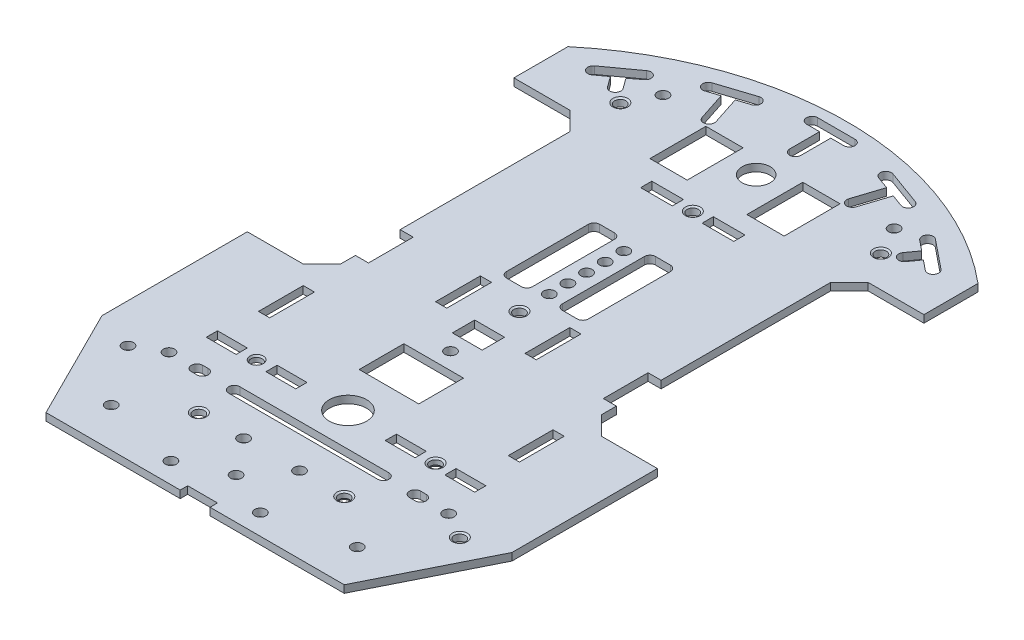
from build123d import *
from OCP.BRepFilletAPI import BRepFilletAPI_MakeChamfer

# Parameters (mm, degrees)
BOSS_EXTRU_1_DEPTH                   = 2
ENL_V_MAT_EXTRU_1_REACH              = 185.45
ENL_V_MAT_EXTRU_43_REACH             = 185.45
ESQUISSE44_R                         = 1.5
ENL_V_MAT_EXTRU_44_REACH             = 185.45
ESQUISSE45_R                         = 1.5
ENL_V_MAT_EXTRU_45_REACH             = 185.45
ESQUISSE46_W                         = 25
ESQUISSE46_H                         = 71.5
CHANFREIN5_SIZE                      = 5
ENL_V_MAT_EXTRU_46_REACH             = 185.45
ESQUISSE47_W                         = 7
ESQUISSE47_H                         = 12
ENL_V_MAT_EXTRU_47_REACH             = 185.45
ESQUISSE48_W                         = 4
ESQUISSE48_H                         = 2
ENL_V_MAT_EXTRU_48_REACH             = 185.45
ESQUISSE49_W                         = 10
ESQUISSE49_H                         = 15
ENL_V_MAT_EXTRU_49_REACH             = 185.45
ESQUISSE50_W                         = 8.5
ESQUISSE50_H                         = 3
ENL_V_MAT_EXTRU_50_REACH             = 185.45
ESQUISSE51_W                         = 7
ESQUISSE51_H                         = 25
CONG_1_R                             = 1.5
ENL_V_MAT_EXTRU_51_REACH             = 185.45
ESQUISSE52_W                         = 3
ESQUISSE52_H                         = 12
ENL_V_MAT_EXTRU_52_REACH             = 185.45
ESQUISSE53_W                         = 4
ESQUISSE53_H                         = 6
ENL_V_MAT_EXTRU_53_REACH             = 185.45
ESQUISSE54_W                         = 8
ESQUISSE54_H                         = 12
ENL_V_MAT_EXTRU_54_REACH             = 185.45
ESQUISSE55_W                         = 3
ESQUISSE55_H                         = 12
ENL_V_MAT_EXTRU_55_REACH             = 185.45
ESQUISSE56_W                         = 8
ESQUISSE56_H                         = 3
ENL_V_MAT_EXTRU_56_REACH             = 185.45
ESQUISSE57_W                         = 8
ESQUISSE57_H                         = 3
ENL_V_MAT_EXTRU_57_REACH             = 185.45
ENL_V_MAT_EXTRU_58_REACH             = 185.45
ESQUISSE59_R                         = 1.5
ENL_V_MAT_EXTRU_58_DIRECTION_2_DEPTH = 184.45026574
ENL_V_MAT_EXTRU_59_REACH             = 185.45
ENL_V_MAT_EXTRU_60_REACH             = 185.45
ESQUISSE61_R                         = 1.5
ENL_V_MAT_EXTRU_61_REACH             = 185.45
ESQUISSE62_R                         = 1.5
ENL_V_MAT_EXTRU_62_REACH             = 185.45
ESQUISSE63_R                         = 1.5
CHANFREIN6_SIZE                      = 0.5
CHANFREIN6_SIZE2                     = 0.288675135
ENL_V_MAT_EXTRU_63_REACH             = 185.45
ESQUISSE64_R                         = 1.5
ENL_V_MAT_EXTRU_64_REACH             = 185.45
ESQUISSE65_R                         = 1.5
ENL_V_MAT_EXTRU_65_REACH             = 185.45
ESQUISSE66_R                         = 1.5
ENL_V_MAT_EXTRU_66_REACH             = 185.45
ESQUISSE67_R                         = 5
ENL_V_MAT_EXTRU_67_REACH             = 185.45
ESQUISSE68_R                         = 1.5
ENL_V_MAT_EXTRU_68_REACH             = 185.45
ESQUISSE69_R                         = 1.5
CHANFREIN7_SIZE                      = 0.5
CHANFREIN7_SIZE2                     = 0.288675135
ENL_V_MAT_EXTRU_69_REACH             = 185.45
ESQUISSE70_R                         = 1.5
R_P_TITION_LIN_AIRE1_COUNT           = 5
R_P_TITION_LIN_AIRE1_PITCH           = 5
ENL_V_MAT_EXTRU_70_REACH             = 185.45
ESQUISSE71_R                         = 1.5
ENL_V_MAT_EXTRU_71_REACH             = 185.45
ESQUISSE72_R                         = 3.75
CHANFREIN8_SIZE                      = 0.5
CHANFREIN8_SIZE2                     = 0.288675135
CHANFREIN9_SIZE                      = 0.5
CHANFREIN9_SIZE2                     = 0.288675135
ENL_V_MAT_EXTRU_72_REACH             = 185.45
ESQUISSE73_R                         = 1.5
CHANFREIN10_SIZE                     = 0.5
CHANFREIN10_SIZE2                    = 0.288675135
CHANFREIN11_SIZE                     = 0.5
CHANFREIN11_SIZE2                    = 0.288675135
ENL_V_MAT_EXTRU_78_REACH             = 185.45
ENL_V_MAT_EXTRU_79_REACH             = 185.45
ENL_V_MAT_EXTRU_80_REACH             = 185.45
CHANFREIN12_SIZE                     = 0.5
CHANFREIN12_SIZE2                    = 0.288675135
CHANFREIN13_SIZE                     = 0.5
CHANFREIN13_SIZE2                    = 0.288675135
CHANFREIN14_SIZE                     = 0.5
CHANFREIN14_SIZE2                    = 0.288675135
CHANFREIN4_SIZE                      = 0.5
CHANFREIN4_SIZE2                     = 0.288675135


# Read off the part's stored shape, not the designer's step: Symétrie1
with BuildPart() as part:
    # Esquisse1 → Boss.-Extru.1 (new body)
    with BuildSketch(Plane(origin=(0, 0, 0), x_dir=(1, 0, 0), z_dir=(0, 1, 0))):
        with BuildLine():
            Line((0, 175), (0, 0))
            Line((0, 0), (55, 0))
            Line((55, 0), (55, 155))
            ThreePointArc((55, 155), (29.261749777, 169.844811886), (0, 175))
        make_face()
    extrude(amount=BOSS_EXTRU_1_DEPTH)

    # Esquisse2 → Enlèv. mat.-Extru.1 (cut, up to next)
    with BuildSketch(Plane(origin=(0, 2, 0), x_dir=(1, 0, 0), z_dir=(0, 1, 0)), mode=Mode.PRIVATE) as enl_v_mat_extru_1_sk1:
        Polygon((55, 0), (40, 0), (55, 30), align=None)
    enl_v_mat_extru_1_tool1 = extrude(enl_v_mat_extru_1_sk1.sketch, amount=-ENL_V_MAT_EXTRU_1_REACH, mode=Mode.PRIVATE) & part.part
    add(enl_v_mat_extru_1_tool1.solids().sort_by_distance((50, 2, -10))[0], mode=Mode.SUBTRACT)

    # Esquisse44 → Enlèv. mat.-Extru.43 (cut, up to next)
    with BuildSketch(Plane(origin=(0, 2, 0), x_dir=(1, 0, 0), z_dir=(0, 1, 0)), mode=Mode.PRIVATE) as enl_v_mat_extru_43_sk1:
        with Locations(Location((44.5, 26.5, 0), (0, 0, 270))):
            Circle(ESQUISSE44_R)
    enl_v_mat_extru_43_tool1 = extrude(enl_v_mat_extru_43_sk1.sketch, amount=-ENL_V_MAT_EXTRU_43_REACH, mode=Mode.PRIVATE) & part.part
    add(enl_v_mat_extru_43_tool1.solids().sort_by_distance((44.5, 2, -26.5))[0], mode=Mode.SUBTRACT)

    # Esquisse45 → Enlèv. mat.-Extru.44 (cut, up to next)
    with BuildSketch(Plane(origin=(0, 2, 0), x_dir=(1, 0, 0), z_dir=(0, 1, 0)), mode=Mode.PRIVATE) as enl_v_mat_extru_44_sk1:
        with Locations(Location((34.946144257, 149, 0), (0, 0, 270))):
            Circle(ESQUISSE45_R)
    enl_v_mat_extru_44_tool1 = extrude(enl_v_mat_extru_44_sk1.sketch, amount=-ENL_V_MAT_EXTRU_44_REACH, mode=Mode.PRIVATE) & part.part
    add(enl_v_mat_extru_44_tool1.solids().sort_by_distance((34.946144, 2, -149))[0], mode=Mode.SUBTRACT)

    # Esquisse46 → Enlèv. mat.-Extru.45 (cut, up to next)
    with BuildSketch(Plane(origin=(0, 2, 0), x_dir=(1, 0, 0), z_dir=(0, 1, 0)), mode=Mode.PRIVATE) as enl_v_mat_extru_45_sk1:
        with Locations((47.5, 104.75)):
            Rectangle(ESQUISSE46_W, ESQUISSE46_H)
    enl_v_mat_extru_45_tool1 = extrude(enl_v_mat_extru_45_sk1.sketch, amount=-ENL_V_MAT_EXTRU_45_REACH, mode=Mode.PRIVATE) & part.part
    add(enl_v_mat_extru_45_tool1.solids().sort_by_distance((47.5, 2, -104.75))[0], mode=Mode.SUBTRACT)

    # Chanfrein5
    chanfrein5_edges = [part.edges().sort_by_distance(p)[0] for p in [
        (35, 1, -69),
        (35, 1, -140.5),
    ]]
    chamfer(chanfrein5_edges, length=CHANFREIN5_SIZE)

    # Esquisse47 → Enlèv. mat.-Extru.46 (cut, up to next)
    with BuildSketch(Plane(origin=(0, 2, 0), x_dir=(1, 0, 0), z_dir=(0, 1, 0)), mode=Mode.PRIVATE) as enl_v_mat_extru_46_sk1:
        with Locations((35, 84)):
            Rectangle(ESQUISSE47_W, ESQUISSE47_H)
    enl_v_mat_extru_46_tool1 = extrude(enl_v_mat_extru_46_sk1.sketch, amount=-ENL_V_MAT_EXTRU_46_REACH, mode=Mode.PRIVATE) & part.part
    add(enl_v_mat_extru_46_tool1.solids().sort_by_distance((35, 2, -84))[0], mode=Mode.SUBTRACT)

    # Esquisse48 → Enlèv. mat.-Extru.47 (cut, up to next)
    with BuildSketch(Plane(origin=(0, 2, 0), x_dir=(1, 0, 0), z_dir=(0, 1, 0)), mode=Mode.PRIVATE) as enl_v_mat_extru_47_sk1:
        with Locations((2, 1)):
            Rectangle(ESQUISSE48_W, ESQUISSE48_H)
    enl_v_mat_extru_47_tool1 = extrude(enl_v_mat_extru_47_sk1.sketch, amount=-ENL_V_MAT_EXTRU_47_REACH, mode=Mode.PRIVATE) & part.part
    add(enl_v_mat_extru_47_tool1.solids().sort_by_distance((2, 2, -1))[0], mode=Mode.SUBTRACT)

    # Esquisse49 → Enlèv. mat.-Extru.48 (cut, up to next)
    with BuildSketch(Plane(origin=(0, 2, 0), x_dir=(1, 0, 0), z_dir=(0, 1, 0)), mode=Mode.PRIVATE) as enl_v_mat_extru_48_sk1:
        with Locations((13, 147.5)):
            Rectangle(ESQUISSE49_W, ESQUISSE49_H)
    enl_v_mat_extru_48_tool1 = extrude(enl_v_mat_extru_48_sk1.sketch, amount=-ENL_V_MAT_EXTRU_48_REACH, mode=Mode.PRIVATE) & part.part
    add(enl_v_mat_extru_48_tool1.solids().sort_by_distance((13, 2, -147.5))[0], mode=Mode.SUBTRACT)

    # Esquisse50 → Enlèv. mat.-Extru.49 (cut, up to next)
    with BuildSketch(Plane(origin=(0, 2, 0), x_dir=(1, 0, 0), z_dir=(0, 1, 0)), mode=Mode.PRIVATE) as enl_v_mat_extru_49_sk1:
        with Locations((8.25, 133.5)):
            Rectangle(ESQUISSE50_W, ESQUISSE50_H)
    enl_v_mat_extru_49_tool1 = extrude(enl_v_mat_extru_49_sk1.sketch, amount=-ENL_V_MAT_EXTRU_49_REACH, mode=Mode.PRIVATE) & part.part
    add(enl_v_mat_extru_49_tool1.solids().sort_by_distance((8.25, 2, -133.5))[0], mode=Mode.SUBTRACT)

    # Esquisse51 → Enlèv. mat.-Extru.50 (cut, up to next)
    with BuildSketch(Plane(origin=(0, 2, 0), x_dir=(1, 0, 0), z_dir=(0, 1, 0)), mode=Mode.PRIVATE) as enl_v_mat_extru_50_sk1:
        with Locations((7.5, 105.5)):
            Rectangle(ESQUISSE51_W, ESQUISSE51_H)
    enl_v_mat_extru_50_tool1 = extrude(enl_v_mat_extru_50_sk1.sketch, amount=-ENL_V_MAT_EXTRU_50_REACH, mode=Mode.PRIVATE) & part.part
    add(enl_v_mat_extru_50_tool1.solids().sort_by_distance((7.5, 2, -105.5))[0], mode=Mode.SUBTRACT)

    # Congé1
    cong_1_edges = [part.edges().sort_by_distance(p)[0] for p in [
        (4, 1, -93),
        (4, 1, -118),
        (11, 1, -118),
        (11, 1, -93),
    ]]
    fillet(cong_1_edges, radius=CONG_1_R)

    # Esquisse52 → Enlèv. mat.-Extru.51 (cut, up to next)
    with BuildSketch(Plane(origin=(0, 2, 0), x_dir=(1, 0, 0), z_dir=(0, 1, 0)), mode=Mode.PRIVATE) as enl_v_mat_extru_51_sk1:
        with Locations((12, 84)):
            Rectangle(ESQUISSE52_W, ESQUISSE52_H)
    enl_v_mat_extru_51_tool1 = extrude(enl_v_mat_extru_51_sk1.sketch, amount=-ENL_V_MAT_EXTRU_51_REACH, mode=Mode.PRIVATE) & part.part
    add(enl_v_mat_extru_51_tool1.solids().sort_by_distance((12, 2, -84))[0], mode=Mode.SUBTRACT)

    # Esquisse53 → Enlèv. mat.-Extru.52 (cut, up to next)
    with BuildSketch(Plane(origin=(0, 2, 0), x_dir=(1, 0, 0), z_dir=(0, 1, 0)), mode=Mode.PRIVATE) as enl_v_mat_extru_52_sk1:
        with Locations((2, 76)):
            Rectangle(ESQUISSE53_W, ESQUISSE53_H)
    enl_v_mat_extru_52_tool1 = extrude(enl_v_mat_extru_52_sk1.sketch, amount=-ENL_V_MAT_EXTRU_52_REACH, mode=Mode.PRIVATE) & part.part
    add(enl_v_mat_extru_52_tool1.solids().sort_by_distance((2, 2, -76))[0], mode=Mode.SUBTRACT)

    # Esquisse54 → Enlèv. mat.-Extru.53 (cut, up to next)
    with BuildSketch(Plane(origin=(0, 2, 0), x_dir=(1, 0, 0), z_dir=(0, 1, 0)), mode=Mode.PRIVATE) as enl_v_mat_extru_53_sk1:
        with Locations((4, 58)):
            Rectangle(ESQUISSE54_W, ESQUISSE54_H)
    enl_v_mat_extru_53_tool1 = extrude(enl_v_mat_extru_53_sk1.sketch, amount=-ENL_V_MAT_EXTRU_53_REACH, mode=Mode.PRIVATE) & part.part
    add(enl_v_mat_extru_53_tool1.solids().sort_by_distance((4, 2, -58))[0], mode=Mode.SUBTRACT)

    # Esquisse55 → Enlèv. mat.-Extru.54 (cut, up to next)
    with BuildSketch(Plane(origin=(0, 2, 0), x_dir=(1, 0, 0), z_dir=(0, 1, 0)), mode=Mode.PRIVATE) as enl_v_mat_extru_54_sk1:
        with Locations((33.5, 58)):
            Rectangle(ESQUISSE55_W, ESQUISSE55_H)
    enl_v_mat_extru_54_tool1 = extrude(enl_v_mat_extru_54_sk1.sketch, amount=-ENL_V_MAT_EXTRU_54_REACH, mode=Mode.PRIVATE) & part.part
    add(enl_v_mat_extru_54_tool1.solids().sort_by_distance((33.5, 2, -58))[0], mode=Mode.SUBTRACT)

    # Esquisse56 → Enlèv. mat.-Extru.55 (cut, up to next)
    with BuildSketch(Plane(origin=(0, 2, 0), x_dir=(1, 0, 0), z_dir=(0, 1, 0)), mode=Mode.PRIVATE) as enl_v_mat_extru_55_sk1:
        with Locations((32, 40.5)):
            Rectangle(ESQUISSE56_W, ESQUISSE56_H)
    enl_v_mat_extru_55_tool1 = extrude(enl_v_mat_extru_55_sk1.sketch, amount=-ENL_V_MAT_EXTRU_55_REACH, mode=Mode.PRIVATE) & part.part
    add(enl_v_mat_extru_55_tool1.solids().sort_by_distance((32, 2, -40.5))[0], mode=Mode.SUBTRACT)

    # Esquisse57 → Enlèv. mat.-Extru.56 (cut, up to next)
    with BuildSketch(Plane(origin=(0, 2, 0), x_dir=(1, 0, 0), z_dir=(0, 1, 0)), mode=Mode.PRIVATE) as enl_v_mat_extru_56_sk1:
        with Locations((16, 40.5)):
            Rectangle(ESQUISSE57_W, ESQUISSE57_H)
    enl_v_mat_extru_56_tool1 = extrude(enl_v_mat_extru_56_sk1.sketch, amount=-ENL_V_MAT_EXTRU_56_REACH, mode=Mode.PRIVATE) & part.part
    add(enl_v_mat_extru_56_tool1.solids().sort_by_distance((16, 2, -40.5))[0], mode=Mode.SUBTRACT)

    # Esquisse58 → Enlèv. mat.-Extru.57 (cut, up to next)
    with BuildSketch(Plane(origin=(0, 2, 0), x_dir=(1, 0, 0), z_dir=(0, 1, 0)), mode=Mode.PRIVATE) as enl_v_mat_extru_57_sk1:
        with BuildLine():
            Line((20, 29), (-20, 29))
            ThreePointArc((-20, 29), (-21.5, 30.5), (-20, 32))
            Line((-20, 32), (20, 32))
            ThreePointArc((20, 32), (21.5, 30.5), (20, 29))
        make_face()
    enl_v_mat_extru_57_tool1 = extrude(enl_v_mat_extru_57_sk1.sketch, amount=-ENL_V_MAT_EXTRU_57_REACH, mode=Mode.PRIVATE) & part.part
    add(enl_v_mat_extru_57_tool1.solids().sort_by_distance((0, 2, -30.5))[0], mode=Mode.SUBTRACT)

    # Esquisse59 → Enlèv. mat.-Extru.58 (cut, up to next)
    with BuildSketch(Plane(origin=(0, 2, 0), x_dir=(1, 0, 0), z_dir=(0, 1, 0)), mode=Mode.PRIVATE) as enl_v_mat_extru_58_sk1:
        with Locations((0, 11)):
            Circle(ESQUISSE59_R)
    enl_v_mat_extru_58_tool1 = extrude(enl_v_mat_extru_58_sk1.sketch, amount=-ENL_V_MAT_EXTRU_58_REACH, mode=Mode.PRIVATE) & part.part
    add(enl_v_mat_extru_58_tool1.solids().sort_by_distance((0, 2, -11))[0], mode=Mode.SUBTRACT)

    # Esquisse59 → Enlèv. mat.-Extru.58 direction 2 (cut)
    with BuildSketch(Plane(origin=(0, 2, 0), x_dir=(1, 0, 0), z_dir=(0, 1, 0))):
        with Locations((0, 11)):
            Circle(ESQUISSE59_R)
    extrude(amount=ENL_V_MAT_EXTRU_58_DIRECTION_2_DEPTH, mode=Mode.SUBTRACT)

    # Esquisse60 → Enlèv. mat.-Extru.59 (cut, up to next)
    with BuildSketch(Plane(origin=(0, 2, 0), x_dir=(1, 0, 0), z_dir=(0, 1, 0)), mode=Mode.PRIVATE) as enl_v_mat_extru_59_sk1:
        with BuildLine():
            Line((28.5, 32), (30, 32))
            ThreePointArc((30, 32), (31.5, 30.5), (30, 29))
            Line((30, 29), (28.5, 29))
            ThreePointArc((28.5, 29), (27, 30.5), (28.5, 32))
        make_face()
    enl_v_mat_extru_59_tool1 = extrude(enl_v_mat_extru_59_sk1.sketch, amount=-ENL_V_MAT_EXTRU_59_REACH, mode=Mode.PRIVATE) & part.part
    add(enl_v_mat_extru_59_tool1.solids().sort_by_distance((29.25, 2, -30.5))[0], mode=Mode.SUBTRACT)

    # Esquisse61 → Enlèv. mat.-Extru.60 (cut, up to next)
    with BuildSketch(Plane(origin=(0, 2, 0), x_dir=(1, 0, 0), z_dir=(0, 1, 0)), mode=Mode.PRIVATE) as enl_v_mat_extru_60_sk1:
        with Locations(Location((37.5, 30.5, 0), (0, 0, 270))):
            Circle(ESQUISSE61_R)
    enl_v_mat_extru_60_tool1 = extrude(enl_v_mat_extru_60_sk1.sketch, amount=-ENL_V_MAT_EXTRU_60_REACH, mode=Mode.PRIVATE) & part.part
    add(enl_v_mat_extru_60_tool1.solids().sort_by_distance((37.5, 2, -30.5))[0], mode=Mode.SUBTRACT)

    # Esquisse62 → Enlèv. mat.-Extru.61 (cut, up to next)
    with BuildSketch(Plane(origin=(0, 2, 0), x_dir=(1, 0, 0), z_dir=(0, 1, 0)), mode=Mode.PRIVATE) as enl_v_mat_extru_61_sk1:
        with Locations(Location((33, 10.5, 0), (0, 0, 270))):
            Circle(ESQUISSE62_R)
    enl_v_mat_extru_61_tool1 = extrude(enl_v_mat_extru_61_sk1.sketch, amount=-ENL_V_MAT_EXTRU_61_REACH, mode=Mode.PRIVATE) & part.part
    add(enl_v_mat_extru_61_tool1.solids().sort_by_distance((33, 2, -10.5))[0], mode=Mode.SUBTRACT)

    # Esquisse63 → Enlèv. mat.-Extru.62 (cut, up to next)
    with BuildSketch(Plane(origin=(0, 2, 0), x_dir=(1, 0, 0), z_dir=(0, 1, 0)), mode=Mode.PRIVATE) as enl_v_mat_extru_62_sk1:
        with Locations(Location((19.5, 20.5, 0), (0, 0, 270))):
            Circle(ESQUISSE63_R)
    enl_v_mat_extru_62_tool1 = extrude(enl_v_mat_extru_62_sk1.sketch, amount=-ENL_V_MAT_EXTRU_62_REACH, mode=Mode.PRIVATE) & part.part
    add(enl_v_mat_extru_62_tool1.solids().sort_by_distance((19.5, 2, -20.5))[0], mode=Mode.SUBTRACT)

    # Chanfrein6
    chanfrein6_edges = [part.edges().sort_by_distance(p)[0] for p in [
        (19.5, 2, -22),
    ]]
    chanfrein6_side = [part.faces().sort_by_distance(p)[0] for p in [
        (23.9660286, 2, -82.408000566),
    ]]
    chamfer(chanfrein6_edges, length=CHANFREIN6_SIZE, length2=CHANFREIN6_SIZE2, reference=chanfrein6_side[0])

    # Esquisse64 → Enlèv. mat.-Extru.63 (cut, up to next)
    with BuildSketch(Plane(origin=(0, 2, 0), x_dir=(1, 0, 0), z_dir=(0, 1, 0)), mode=Mode.PRIVATE) as enl_v_mat_extru_63_sk1:
        with Locations(Location((7.5, 20.5, 0), (0, 0, 270))):
            Circle(ESQUISSE64_R)
    enl_v_mat_extru_63_tool1 = extrude(enl_v_mat_extru_63_sk1.sketch, amount=-ENL_V_MAT_EXTRU_63_REACH, mode=Mode.PRIVATE) & part.part
    add(enl_v_mat_extru_63_tool1.solids().sort_by_distance((7.5, 2, -20.5))[0], mode=Mode.SUBTRACT)

    # Esquisse65 → Enlèv. mat.-Extru.64 (cut, up to next)
    with BuildSketch(Plane(origin=(0, 2, 0), x_dir=(1, 0, 0), z_dir=(0, 1, 0)), mode=Mode.PRIVATE) as enl_v_mat_extru_64_sk1:
        with Locations(Location((12, 5.5, 0), (0, 0, 270))):
            Circle(ESQUISSE65_R)
    enl_v_mat_extru_64_tool1 = extrude(enl_v_mat_extru_64_sk1.sketch, amount=-ENL_V_MAT_EXTRU_64_REACH, mode=Mode.PRIVATE) & part.part
    add(enl_v_mat_extru_64_tool1.solids().sort_by_distance((12, 2, -5.5))[0], mode=Mode.SUBTRACT)

    # Esquisse66 → Enlèv. mat.-Extru.65 (cut, up to next)
    with BuildSketch(Plane(origin=(0, 2, 0), x_dir=(1, 0, 0), z_dir=(0, 1, 0)), mode=Mode.PRIVATE) as enl_v_mat_extru_65_sk1:
        with Locations(Location((24, 40.5, 0), (0, 0, 270))):
            Circle(ESQUISSE66_R)
    enl_v_mat_extru_65_tool1 = extrude(enl_v_mat_extru_65_sk1.sketch, amount=-ENL_V_MAT_EXTRU_65_REACH, mode=Mode.PRIVATE) & part.part
    add(enl_v_mat_extru_65_tool1.solids().sort_by_distance((24, 2, -40.5))[0], mode=Mode.SUBTRACT)

    # Esquisse67 → Enlèv. mat.-Extru.66 (cut, up to next)
    with BuildSketch(Plane(origin=(0, 2, 0), x_dir=(1, 0, 0), z_dir=(0, 1, 0)), mode=Mode.PRIVATE) as enl_v_mat_extru_66_sk1:
        with Locations((0, 41)):
            Circle(ESQUISSE67_R)
    enl_v_mat_extru_66_tool1 = extrude(enl_v_mat_extru_66_sk1.sketch, amount=-ENL_V_MAT_EXTRU_66_REACH, mode=Mode.PRIVATE) & part.part
    add(enl_v_mat_extru_66_tool1.solids().sort_by_distance((0, 2, -41))[0], mode=Mode.SUBTRACT)

    # Esquisse68 → Enlèv. mat.-Extru.67 (cut, up to next)
    with BuildSketch(Plane(origin=(0, 2, 0), x_dir=(1, 0, 0), z_dir=(0, 1, 0)), mode=Mode.PRIVATE) as enl_v_mat_extru_67_sk1:
        with Locations((0, 68.5)):
            Circle(ESQUISSE68_R)
    enl_v_mat_extru_67_tool1 = extrude(enl_v_mat_extru_67_sk1.sketch, amount=-ENL_V_MAT_EXTRU_67_REACH, mode=Mode.PRIVATE) & part.part
    add(enl_v_mat_extru_67_tool1.solids().sort_by_distance((0, 2, -68.5))[0], mode=Mode.SUBTRACT)

    # Esquisse69 → Enlèv. mat.-Extru.68 (cut, up to next)
    with BuildSketch(Plane(origin=(0, 2, 0), x_dir=(1, 0, 0), z_dir=(0, 1, 0)), mode=Mode.PRIVATE) as enl_v_mat_extru_68_sk1:
        with Locations((0, 87)):
            Circle(ESQUISSE69_R)
    enl_v_mat_extru_68_tool1 = extrude(enl_v_mat_extru_68_sk1.sketch, amount=-ENL_V_MAT_EXTRU_68_REACH, mode=Mode.PRIVATE) & part.part
    add(enl_v_mat_extru_68_tool1.solids().sort_by_distance((0, 2, -87))[0], mode=Mode.SUBTRACT)

    # Chanfrein7
    chanfrein7_edges = [part.edges().sort_by_distance(p)[0] for p in [
        (1.5, 2, -87),
    ]]
    chanfrein7_side = [part.faces().sort_by_distance(p)[0] for p in [
        (24.148972465, 2, -82.888348939),
    ]]
    chamfer(chanfrein7_edges, length=CHANFREIN7_SIZE, length2=CHANFREIN7_SIZE2, reference=chanfrein7_side[0])

    # Esquisse70 → Enlèv. mat.-Extru.69 (cut, up to next)
    with BuildSketch(Plane(origin=(0, 2, 0), x_dir=(1, 0, 0), z_dir=(0, 1, 0)), mode=Mode.PRIVATE) as enl_v_mat_extru_69_sk1:
        with Locations((0, 95)):
            Circle(ESQUISSE70_R)
    enl_v_mat_extru_69_tool1 = extrude(enl_v_mat_extru_69_sk1.sketch, amount=-ENL_V_MAT_EXTRU_69_REACH, mode=Mode.PRIVATE) & part.part
    enl_v_mat_extru_69 = enl_v_mat_extru_69_tool1.solids().sort_by_distance((0, 2, -95))[0]
    add(enl_v_mat_extru_69, mode=Mode.SUBTRACT)

    # Répétition linéaire1: Enlèv. mat.-Extru.69 ×5
    with Locations(*[(0, 0, -i * R_P_TITION_LIN_AIRE1_PITCH) for i in range(1, R_P_TITION_LIN_AIRE1_COUNT)]):
        add(enl_v_mat_extru_69, mode=Mode.SUBTRACT)

    # Esquisse71 → Enlèv. mat.-Extru.70 (cut, up to next)
    with BuildSketch(Plane(origin=(0, 2, 0), x_dir=(1, 0, 0), z_dir=(0, 1, 0)), mode=Mode.PRIVATE) as enl_v_mat_extru_70_sk1:
        with Locations((0, 133.5)):
            Circle(ESQUISSE71_R)
    enl_v_mat_extru_70_tool1 = extrude(enl_v_mat_extru_70_sk1.sketch, amount=-ENL_V_MAT_EXTRU_70_REACH, mode=Mode.PRIVATE) & part.part
    add(enl_v_mat_extru_70_tool1.solids().sort_by_distance((0, 2, -133.5))[0], mode=Mode.SUBTRACT)

    # Esquisse72 → Enlèv. mat.-Extru.71 (cut, up to next)
    with BuildSketch(Plane(origin=(0, 2, 0), x_dir=(1, 0, 0), z_dir=(0, 1, 0)), mode=Mode.PRIVATE) as enl_v_mat_extru_71_sk1:
        with Locations((0, 150.5)):
            Circle(ESQUISSE72_R)
    enl_v_mat_extru_71_tool1 = extrude(enl_v_mat_extru_71_sk1.sketch, amount=-ENL_V_MAT_EXTRU_71_REACH, mode=Mode.PRIVATE) & part.part
    add(enl_v_mat_extru_71_tool1.solids().sort_by_distance((0, 2, -150.5))[0], mode=Mode.SUBTRACT)

    # Chanfrein8
    chanfrein8_edges = [part.edges().sort_by_distance(p)[0] for p in [
        (1.5, 2, -133.5),
    ]]
    chanfrein8_side = [part.faces().sort_by_distance(p)[0] for p in [
        (24.305438723, 2, -82.582195054),
    ]]
    chamfer(chanfrein8_edges, length=CHANFREIN8_SIZE, length2=CHANFREIN8_SIZE2, reference=chanfrein8_side[0])

    # Chanfrein9
    chanfrein9_edges = [part.edges().sort_by_distance(p)[0] for p in [
        (34.946144257, 2, -150.5),
    ]]
    chanfrein9_side = [part.faces().sort_by_distance(p)[0] for p in [
        (24.314848113, 2, -82.561529503),
    ]]
    chamfer(chanfrein9_edges, length=CHANFREIN9_SIZE, length2=CHANFREIN9_SIZE2, reference=chanfrein9_side[0])

    # Esquisse73 → Enlèv. mat.-Extru.72 (cut, up to next)
    with BuildSketch(Plane(origin=(0, 2, 0), x_dir=(1, 0, 0), z_dir=(0, 1, 0)), mode=Mode.PRIVATE) as enl_v_mat_extru_72_sk1:
        with Locations(Location((31, 156.5, 0), (0, 0, 270))):
            Circle(ESQUISSE73_R)
    enl_v_mat_extru_72_tool1 = extrude(enl_v_mat_extru_72_sk1.sketch, amount=-ENL_V_MAT_EXTRU_72_REACH, mode=Mode.PRIVATE) & part.part
    add(enl_v_mat_extru_72_tool1.solids().sort_by_distance((31, 2, -156.5))[0], mode=Mode.SUBTRACT)

    # Symétrie1: part across plane


with BuildPart() as part_1:
    add(part.part)
    add(part.part.mirror(Plane(origin=(0, 2, -175), x_dir=(0, 0, 1), z_dir=(1, 0, 0))))

    # Chanfrein10
    chanfrein10_edges = [part_1.edges().sort_by_distance(p)[0] for p in [
        (-24, 2, -42),
    ]]
    chanfrein10_side = [part_1.faces().sort_by_distance(p)[0] for p in [
        (-24, 1, -42),
    ]]
    chamfer(chanfrein10_edges, length=CHANFREIN10_SIZE, length2=CHANFREIN10_SIZE2, reference=chanfrein10_side[0])

    # Chanfrein11
    chanfrein11_edges = [part_1.edges().sort_by_distance(p)[0] for p in [
        (24, 2, -42),
    ]]
    chanfrein11_side = [part_1.faces().sort_by_distance(p)[0] for p in [
        (0.00529521, 2, -82.439442132),
    ]]
    chamfer(chanfrein11_edges, length=CHANFREIN11_SIZE, length2=CHANFREIN11_SIZE2, reference=chanfrein11_side[0])

    # Esquisse74 → Enlèv. mat.-Extru.78 (cut, up to next)
    with BuildSketch(Plane(origin=(0, 2, 0), x_dir=(1, 0, 0), z_dir=(0, 1, 0)), mode=Mode.PRIVATE) as enl_v_mat_extru_78_sk1:
        with BuildLine():
            Line((-5, 172), (5, 172))
            ThreePointArc((5, 172), (6.5, 170.5), (5, 169))
            Line((5, 169), (-5, 169))
            ThreePointArc((-5, 169), (-6.5, 170.5), (-5, 172))
        make_face()
    enl_v_mat_extru_78_tool1 = extrude(enl_v_mat_extru_78_sk1.sketch, amount=-ENL_V_MAT_EXTRU_78_REACH, mode=Mode.PRIVATE) & part_1.part
    add(enl_v_mat_extru_78_tool1.solids().sort_by_distance((0, 2, -170.5))[0], mode=Mode.SUBTRACT)

    # Esquisse75 → Enlèv. mat.-Extru.79 (cut, up to next)
    with BuildSketch(Plane(origin=(0, 2, 0), x_dir=(1, 0, 0), z_dir=(0, 1, 0)), mode=Mode.PRIVATE) as enl_v_mat_extru_79_sk1:
        with BuildLine():
            Line((-1.5, 161), (-1.5, 170))
            ThreePointArc((-1.5, 170), (0, 171.5), (1.5, 170))
            Line((1.5, 170), (1.5, 161))
            ThreePointArc((1.5, 161), (0, 159.5), (-1.5, 161))
        make_face()
    enl_v_mat_extru_79_tool1 = extrude(enl_v_mat_extru_79_sk1.sketch, amount=-ENL_V_MAT_EXTRU_79_REACH, mode=Mode.PRIVATE) & part_1.part
    add(enl_v_mat_extru_79_tool1.solids().sort_by_distance((0, 2, -165.5))[0], mode=Mode.SUBTRACT)

    # Esquisse77 → Enlèv. mat.-Extru.80 (cut, up to next)
    with BuildSketch(Plane(origin=(0, 2, 0), x_dir=(1, 0, 0), z_dir=(0, 1, 0)), mode=Mode.PRIVATE) as enl_v_mat_extru_80_sk1:
        with BuildLine():
            Line((-40.301244769, 150.917952247), (-42.358493152, 153.749511728))
            Line((-42.358493152, 153.749511728), (-45.190052632, 151.692263345))
            ThreePointArc((-45.190052632, 151.692263345), (-47.285256002, 152.024110958), (-46.953408389, 154.119314328))
            Line((-46.953408389, 154.119314328), (-38.863238445, 159.997166851))
            ThreePointArc((-38.863238445, 159.997166851), (-36.768035075, 159.665319238), (-37.099882689, 157.570115868))
            Line((-37.099882689, 157.570115868), (-39.878013124, 155.439328713))
            Line((-39.878013124, 155.439328713), (-37.874193786, 152.681308004))
            ThreePointArc((-37.874193786, 152.681308004), (-38.206041399, 150.586104634), (-40.301244769, 150.917952247))
        make_face()
    enl_v_mat_extru_80_tool1 = extrude(enl_v_mat_extru_80_sk1.sketch, amount=-ENL_V_MAT_EXTRU_80_REACH, mode=Mode.PRIVATE) & part_1.part
    # Esquisse77 → Enlèv. mat.-Extru.80 (cut, up to next)
    with BuildSketch(Plane(origin=(0, 2, 0), x_dir=(1, 0, 0), z_dir=(0, 1, 0)), mode=Mode.PRIVATE) as enl_v_mat_extru_80_sk2:
        with BuildLine():
            Line((-16.861854741, 166.150750874), (-20.190552548, 165.069191394))
            Line((-20.190552548, 165.069191394), (-17.718416593, 157.460739264))
            ThreePointArc((-17.718416593, 157.460739264), (-18.681475876, 155.570628998), (-20.571586142, 156.533688281))
            Line((-20.571586142, 156.533688281), (-23.043722097, 164.142140411))
            Line((-23.043722097, 164.142140411), (-26.372419904, 163.060580931))
            ThreePointArc((-26.372419904, 163.060580931), (-28.26253017, 164.023640214), (-27.299470887, 165.91375048))
            Line((-27.299470887, 165.91375048), (-17.788905724, 169.003920423))
            ThreePointArc((-17.788905724, 169.003920423), (-15.898795458, 168.04086114), (-16.861854741, 166.150750874))
        make_face()
    enl_v_mat_extru_80_tool2 = extrude(enl_v_mat_extru_80_sk2.sketch, amount=-ENL_V_MAT_EXTRU_80_REACH, mode=Mode.PRIVATE) & part_1.part
    # Esquisse77 → Enlèv. mat.-Extru.80 (cut, up to next)
    with BuildSketch(Plane(origin=(0, 2, 0), x_dir=(1, 0, 0), z_dir=(0, 1, 0)), mode=Mode.PRIVATE) as enl_v_mat_extru_80_sk3:
        with BuildLine():
            Line((38.99175186, 159.586260097), (46.774736635, 153.307315281))
            ThreePointArc((46.774736635, 153.307315281), (47.000342629, 151.198025842), (44.89105319, 150.972419849))
            Line((44.89105319, 150.972419849), (42.227537525, 153.121218588))
            Line((42.227537525, 153.121218588), (40.212246338, 150.347408234))
            ThreePointArc((40.212246338, 150.347408234), (38.117042968, 150.015560621), (37.785195355, 152.110763991))
            Line((37.785195355, 152.110763991), (39.889658518, 155.007309041))
            Line((39.889658518, 155.007309041), (37.108068416, 157.251364664))
            ThreePointArc((37.108068416, 157.251364664), (36.882462422, 159.360654103), (38.99175186, 159.586260097))
        make_face()
    enl_v_mat_extru_80_tool3 = extrude(enl_v_mat_extru_80_sk3.sketch, amount=-ENL_V_MAT_EXTRU_80_REACH, mode=Mode.PRIVATE) & part_1.part
    # Esquisse77 → Enlèv. mat.-Extru.80 (cut, up to next)
    with BuildSketch(Plane(origin=(0, 2, 0), x_dir=(1, 0, 0), z_dir=(0, 1, 0)), mode=Mode.PRIVATE) as enl_v_mat_extru_80_sk4:
        with BuildLine():
            Line((18.178906704, 169.023528973), (27.57523739, 165.601691671))
            ThreePointArc((27.57523739, 165.601691671), (28.471620026, 163.679063738), (26.548992092, 162.782681102))
            Line((26.548992092, 162.782681102), (23.31064327, 163.961584186))
            Line((23.31064327, 163.961584186), (20.853211869, 156.398388022))
            ThreePointArc((20.853211869, 156.398388022), (18.963101603, 155.435328739), (18.00004232, 157.325439005))
            Line((18.00004232, 157.325439005), (20.489907923, 164.98845738))
            Line((20.489907923, 164.98845738), (17.152290209, 166.203498758))
            ThreePointArc((17.152290209, 166.203498758), (16.255583349, 168.126822112), (18.178906704, 169.023528973))
        make_face()
    enl_v_mat_extru_80_tool4 = extrude(enl_v_mat_extru_80_sk4.sketch, amount=-ENL_V_MAT_EXTRU_80_REACH, mode=Mode.PRIVATE) & part_1.part
    add(enl_v_mat_extru_80_tool1.solids().sort_by_distance((-41.397446, 2, -154.992775))[0], mode=Mode.SUBTRACT)
    add(enl_v_mat_extru_80_tool2.solids().sort_by_distance((-21.277896, 2, -163.56159))[0], mode=Mode.SUBTRACT)
    add(enl_v_mat_extru_80_tool3.solids().sort_by_distance((41.316892, 2, -154.423563))[0], mode=Mode.SUBTRACT)
    add(enl_v_mat_extru_80_tool4.solids().sort_by_distance((21.559093, 2, -163.430742))[0], mode=Mode.SUBTRACT)

    # Chanfrein12
    chanfrein12_edges = [part_1.edges().sort_by_distance(p)[0] for p in [
        (24, 0, -42),
    ]]
    chanfrein12_side = [part_1.faces().sort_by_distance(p)[0] for p in [
        (24, 0.855662433, -42),
    ]]
    chamfer(chanfrein12_edges, length=CHANFREIN12_SIZE, length2=CHANFREIN12_SIZE2, reference=chanfrein12_side[0])

    # Chanfrein13
    chanfrein13_edges = [part_1.edges().sort_by_distance(p)[0] for p in [
        (-24, 0, -42),
    ]]
    chanfrein13_side = [part_1.faces().sort_by_distance(p)[0] for p in [
        (-0.006042211, 0, -80.701323303),
    ]]
    chamfer(chanfrein13_edges, length=CHANFREIN13_SIZE, length2=CHANFREIN13_SIZE2, reference=chanfrein13_side[0])

    # Chanfrein14: one chamfer whose edges measure the first distance from different faces: ONE call of the kernel's chamfer builder (chamfer() names one face for all edges)
    chanfrein14_edges_1 = [part_1.edges().sort_by_distance(p)[0] for p in [
        (19.5, 0, -22),
    ]]
    chanfrein14_side_1 = [part_1.faces().sort_by_distance(p)[0] for p in [
        (19.5, 0.855662433, -22),
    ]]
    chanfrein14_edges_2 = [part_1.edges().sort_by_distance(p)[0] for p in [
        (-19.5, 0, -22),
    ]]
    chanfrein14_side_2 = [part_1.faces().sort_by_distance(p)[0] for p in [
        (0.003914177, 0, -80.718005002),
    ]]
    chanfrein14 = BRepFilletAPI_MakeChamfer(part_1.part.solid().wrapped)
    for e in chanfrein14_edges_1:
        chanfrein14.Add(CHANFREIN14_SIZE, CHANFREIN14_SIZE2, e.wrapped, chanfrein14_side_1[0].wrapped)  # the first distance lies on this face
    for e in chanfrein14_edges_2:
        chanfrein14.Add(CHANFREIN14_SIZE, CHANFREIN14_SIZE2, e.wrapped, chanfrein14_side_2[0].wrapped)  # the first distance lies on this face
    add(Compound.cast(chanfrein14.Shape()), mode=Mode.REPLACE)

    # Chanfrein4
    chanfrein4_edges = [part_1.edges().sort_by_distance(p)[0] for p in [
        (44.5, 2, -28),
    ]]
    chanfrein4_side = [part_1.faces().sort_by_distance(p)[0] for p in [
        (-0.005211372, 2, -80.686725919),
    ]]
    chamfer(chanfrein4_edges, length=CHANFREIN4_SIZE, length2=CHANFREIN4_SIZE2, reference=chanfrein4_side[0])


solid = part_1.part
